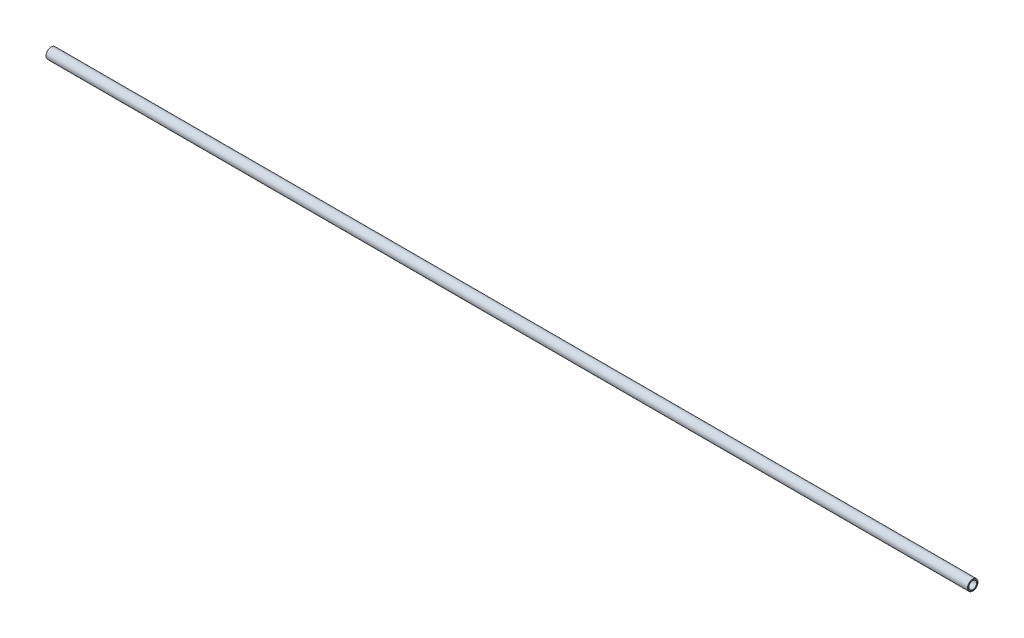
from build123d import *

# Parameters (mm, degrees)
SKETCH1_R           = 12.7
SKETCH1_R_2         = 9.525
BOSS_EXTRUDE1_DEPTH = 2235.2
CHAMFER1_SIZE       = 0.508


with BuildPart() as part:
    # Sketch1 → Boss-Extrude1 (new body)
    with BuildSketch(Plane(origin=(0, 0, 0), x_dir=(0, 0, -1), z_dir=(1, 0, 0))):
        Circle(SKETCH1_R)
        Circle(SKETCH1_R_2, mode=Mode.SUBTRACT)
    extrude(amount=BOSS_EXTRUDE1_DEPTH)

    # Chamfer1
    chamfer1_edges = [part.edges().sort_by_distance(p)[0] for p in [
        (0, 0, 9.525),
        (0, 0, 12.7),
        (2235.2, 0, 12.7),
        (2235.2, 0, 9.525),
    ]]
    chamfer(chamfer1_edges, length=CHAMFER1_SIZE)


solid = part.part
